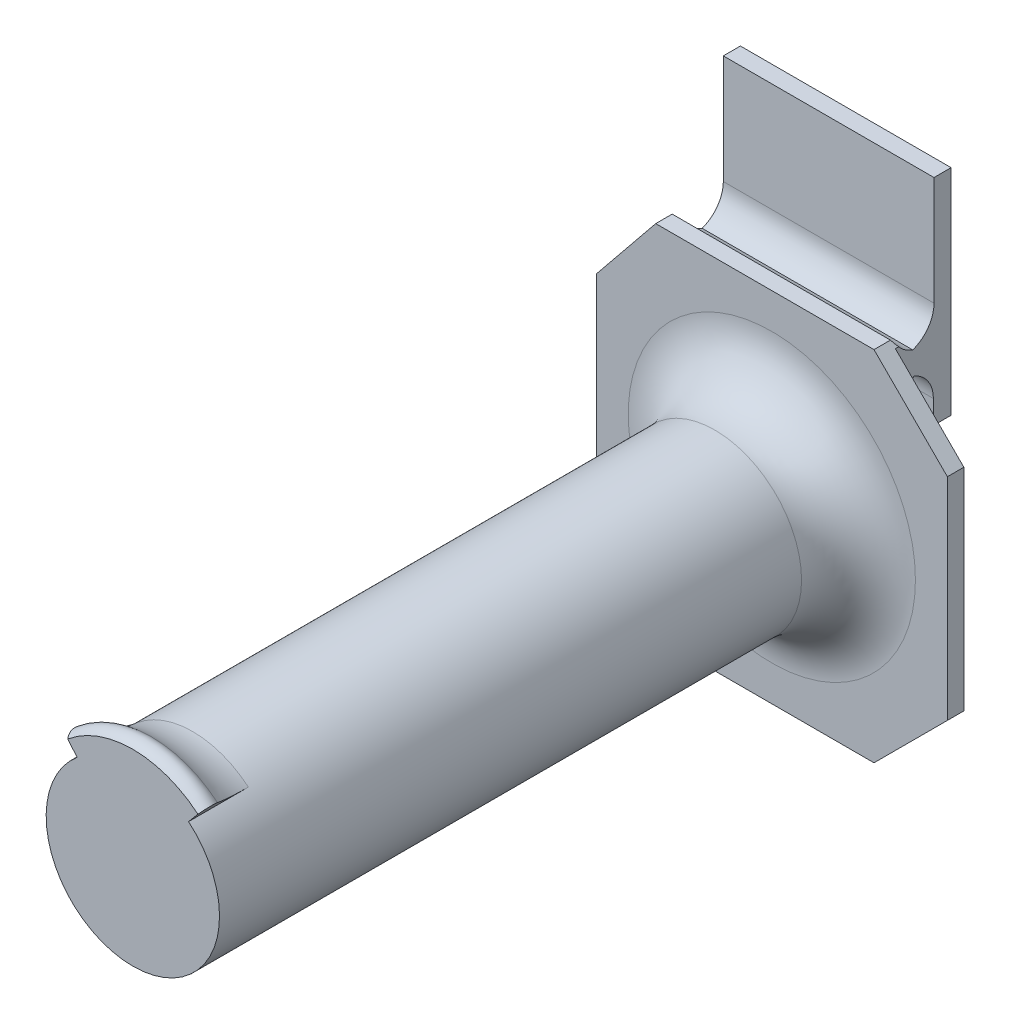
from build123d import *

# Parameters (mm, degrees)
SKETCH1_R                = 13.7
BOSS_EXTRUDE1_DEPTH      = 101
SKETCH5_W                = 55.5
SKETCH5_H                = 56.561345004
BOSS_EXTRUDE2_DEPTH      = 2.6
CUT_EXTRUDE4_DEPTH       = 2.6
BOSS_EXTRUDE4_DEPTH      = 6
SKETCH8_W                = 33.3
SKETCH8_H                = 11.7
BOSS_EXTRUDE5_DEPTH      = 2.8
SKETCH9_W                = 33.3
SKETCH9_H                = 2.7
BOSS_EXTRUDE6_DEPTH      = 22.2
FILLET2_R                = 5
REVOLVE1_ANGLE           = 40
REVOLVE1_OTHER_WAY_ANGLE = 40
FILLET6_R                = 9


with BuildPart() as part:
    # Sketch1 → Boss-Extrude1 (new body)
    with BuildSketch(Plane.XY):
        with Locations(Location((0, 0, 0), (0, 0, 180))):
            Circle(SKETCH1_R)
    extrude(amount=BOSS_EXTRUDE1_DEPTH)

    # Sketch5 → Boss-Extrude2 (add)
    with BuildSketch(Plane(origin=(0, 0, 0), x_dir=(-1, 0, 0), z_dir=(0, 0, -1))):
        Rectangle(SKETCH5_W, SKETCH5_H)
    extrude(amount=BOSS_EXTRUDE2_DEPTH)

    # Sketch6 → Cut-Extrude4 (cut)
    with BuildSketch(Plane(origin=(0, 0, -2.6), x_dir=(-1, 0, 0), z_dir=(0, 0, -1))):
        Polygon((27.75, 28.280672502), (18.35, 28.280672502), (27.75, 16.680672502), align=None)
        Polygon((-16.15, -28.280672502), (-27.75, -16.680672502), (-27.75, -28.280672502), align=None)
        Polygon((27.75, -18.880672502), (18.35, -28.280672502), (27.75, -28.280672502), align=None)
        Polygon((-27.75, 16.680672502), (-27.75, 28.280672502), (-16.15, 28.280672502), align=None)
    extrude(amount=-CUT_EXTRUDE4_DEPTH, mode=Mode.SUBTRACT)

    # Sketch7 → Boss-Extrude4 (add)
    with BuildSketch(Plane(origin=(0, 0, -2.6), x_dir=(-1, 0, 0), z_dir=(0, 0, -1))):
        Polygon((1.1, 25.680672502), (16.366645995, 25.680672502), (16.366645995, 22.680672502), (-16.933354005, 22.680672502), (-16.933354005, 25.680672502), align=None)
    extrude(amount=BOSS_EXTRUDE4_DEPTH)

    # Sketch8 → Boss-Extrude5 (add)
    with BuildSketch(Plane(origin=(0, 0, -8.6), x_dir=(-1, 0, 0), z_dir=(0, 0, -1))):
        with Locations((-0.283354005, 19.830672502)):
            Rectangle(SKETCH8_W, SKETCH8_H)
    extrude(amount=BOSS_EXTRUDE5_DEPTH)

    # Sketch9 → Boss-Extrude6 (add)
    with BuildSketch(Plane(origin=(0, 25.680672502, 0), x_dir=(1, 0, 0), z_dir=(0, 1, 0))):
        with Locations((0.283354005, 10.05)):
            Rectangle(SKETCH9_W, SKETCH9_H)
    extrude(amount=BOSS_EXTRUDE6_DEPTH)

    # Fillet2
    # the kernel refuses this fillet: 5 mm, written as the material it adds along each edge
    with BuildSketch(Plane(origin=(-16.366645995, 25.680672502, -2.6), x_dir=(0, 1, 0), z_dir=(1, 0, 0))) as fillet2_piece_1_section:
        with BuildLine():
            CenterArc((5, -4.38634244), FILLET2_R, 118.685402014, 61.314597986)
            Line((0, -4.38634244), (-0.1, -4.38634244))
            Line((-0.1, -4.38634244), (-0.1, 0))
            Line((-0.1, 0), (0, 0.1))
            ThreePointArc((0, 0.1), (1.3, 0.1), (2.552, 0.087726849))
            Line((2.552, 0.087726849), (2.6, 0))
        make_face()
    fillet2_piece_1 = extrude(amount=33.3, mode=Mode.PRIVATE)
    fillet2_piece_1 = split(fillet2_piece_1, bisect_by=Plane(origin=(9.175527955, 35.255144547, -3.690317045), z_dir=(-0.7071067811865442, -0.7071067811865509, 0)), keep=Keep.TOP, mode=Mode.PRIVATE)
    add(fillet2_piece_1)
    with BuildSketch(Plane(origin=(-16.366645995, 22.680672502, -2.6), x_dir=(0, -1, 0), z_dir=(1, 0, 0))) as fillet2_piece_2:
        with BuildLine():
            CenterArc((FILLET2_R, FILLET2_R), FILLET2_R, 180, 90)
            Line((0, FILLET2_R), (-FILLET2_R * 0.02, FILLET2_R))
            Line((-FILLET2_R * 0.02, FILLET2_R), (-FILLET2_R * 0.02, -FILLET2_R * 0.02))
            Line((-FILLET2_R * 0.02, -FILLET2_R * 0.02), (FILLET2_R, -FILLET2_R * 0.02))
            Line((FILLET2_R, -FILLET2_R * 0.02), (FILLET2_R, 0))
        make_face()
    extrude(amount=33.3)
    with BuildSketch(Plane(origin=(-16.366645995, 22.680672502, -8.6), x_dir=(0, -1, 0), z_dir=(1, 0, 0)), Plane(origin=(16.933354005, 25.680672502, -8.7), x_dir=(0, 1, 0), z_dir=(-1, 0, 0))) as fillet2_piece_3:
        with BuildLine():
            CenterArc((FILLET2_R, -FILLET2_R), FILLET2_R, 90, 90)
            Line((0, -FILLET2_R), (-FILLET2_R * 0.02, -FILLET2_R))
            Line((-FILLET2_R * 0.02, -FILLET2_R), (-FILLET2_R * 0.02, FILLET2_R * 0.02))
            Line((-FILLET2_R * 0.02, FILLET2_R * 0.02), (FILLET2_R, FILLET2_R * 0.02))
            Line((FILLET2_R, FILLET2_R * 0.02), (FILLET2_R, 0))
        make_face()
    extrude(amount=33.3)

    # Sketch10 → Revolve1 (revolve)
    with BuildSketch(Plane.ZY):
        with BuildLine():
            Line((101, 13.7), (101, 16))
            ThreePointArc((101, 16), (99.554707727, 16.71784268), (98.02630764, 16.2))
            ThreePointArc((98.02630764, 16.2), (94.964280854, 14.479645567), (91.539696179, 13.7))
            Line((91.539696179, 13.7), (101, 13.7))
        make_face()
    revolve(axis=Axis((0, 0, 101.100764075), (0, 0, -1)), revolution_arc=REVOLVE1_ANGLE)

    # Sketch10 → Revolve1 other way (revolve)
    with BuildSketch(Plane.ZY):
        with BuildLine():
            Line((101, 13.7), (101, 16))
            ThreePointArc((101, 16), (99.554707727, 16.71784268), (98.02630764, 16.2))
            ThreePointArc((98.02630764, 16.2), (94.964280854, 14.479645567), (91.539696179, 13.7))
            Line((91.539696179, 13.7), (101, 13.7))
        make_face()
    revolve(axis=Axis((0, 0, 101.100764075), (0, 0, 1)), revolution_arc=REVOLVE1_OTHER_WAY_ANGLE)

    # Fillet6
    fillet6_edges = [part.edges().sort_by_distance(p)[0] for p in [
        (13.7, 0, 0),
    ]]
    fillet(fillet6_edges, radius=FILLET6_R)


solid = part.part
